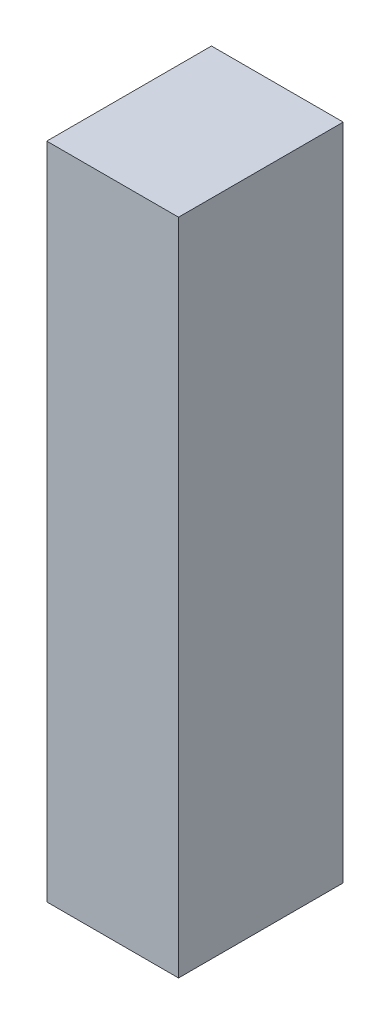
from build123d import *

# Parameters (mm, degrees)
BOSS_EXTRUDE1_DEPTH      = 10
BOSS_EXTRUDE1_DEPTH_BACK = 50
SKETCH1_W                = 12
SKETCH1_H                = 15


with BuildPart() as part:
    # Sketch1 → Boss-Extrude1 (new, two sides: drawn at the far end of the back side and taken through both)
    with BuildSketch(Plane(origin=(0, 0, 0), x_dir=(1, 0, 0), z_dir=(0, 1, 0)).offset(-BOSS_EXTRUDE1_DEPTH_BACK)):
        Rectangle(SKETCH1_W, SKETCH1_H)
    extrude(amount=BOSS_EXTRUDE1_DEPTH + BOSS_EXTRUDE1_DEPTH_BACK)


solid = part.part
